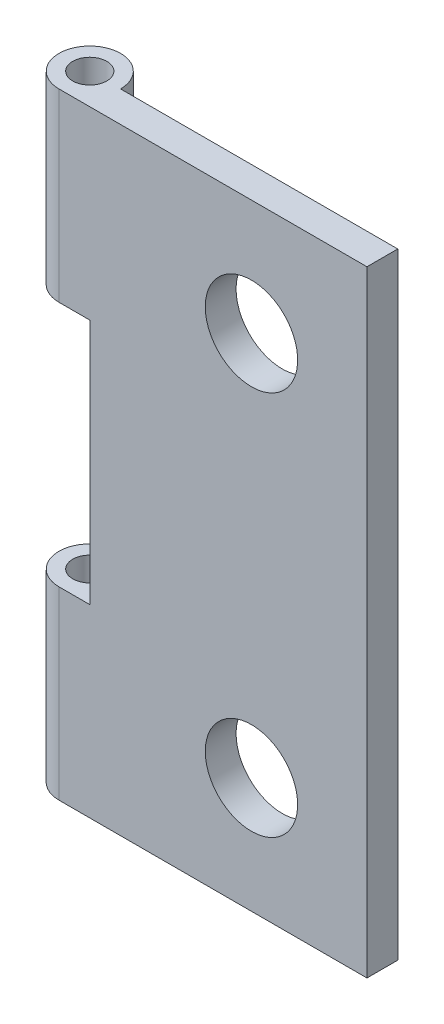
from build123d import *

# Parameters (mm, degrees)
SKETCH_1_R               = 1.107438874
EXTRUDE_1_DEPTH          = 40
CUT_EXTRUDE_1_DEPTH      = 40
CUT_EXTRUDE_1_DEPTH_BACK = 40
SKETCH_3_W               = 4
SKETCH_3_H               = 16
SKETCH_5_R               = 3
CUT_EXTRUDE_2_DEPTH      = 10


with BuildPart() as part:
    # 草图1 → 凸台-拉伸1 (new body)
    with BuildSketch(Plane(origin=(0, 0, 0), x_dir=(1, 0, 0), z_dir=(0, 1, 0))):
        with BuildLine():
            ThreePointArc((-8, 1), (-11.414213562, 2.414213562), (-10, -1))
            Line((-10, -1), (10, -1))
            Line((10, -1), (10, 1))
            Line((10, 1), (-8, 1))
        make_face()
        with Locations((-10, 1)):
            Circle(SKETCH_1_R, mode=Mode.SUBTRACT)
    extrude(amount=EXTRUDE_1_DEPTH)

    # 草图3 → 切除-拉伸1 (cut, two sides: drawn at the far end of the back side and taken through both)
    with BuildSketch(Plane(origin=(0, 0, -1), x_dir=(-1, 0, 0), z_dir=(0, 0, -1)).offset(-CUT_EXTRUDE_1_DEPTH_BACK)):
        with Locations((10, 20)):
            Rectangle(SKETCH_3_W, SKETCH_3_H)
    extrude(amount=CUT_EXTRUDE_1_DEPTH + CUT_EXTRUDE_1_DEPTH_BACK, mode=Mode.SUBTRACT)

    # 草图5 → 切除-拉伸2 (cut)
    with BuildSketch(Plane(origin=(0, 0, -1), x_dir=(-1, 0, 0), z_dir=(0, 0, -1))):
        with Locations((-2.5, 7.5)):
            Circle(SKETCH_5_R)
        with Locations((-2.5, 32.5)):
            Circle(SKETCH_5_R)
    extrude(amount=-CUT_EXTRUDE_2_DEPTH, mode=Mode.SUBTRACT)


solid = part.part
